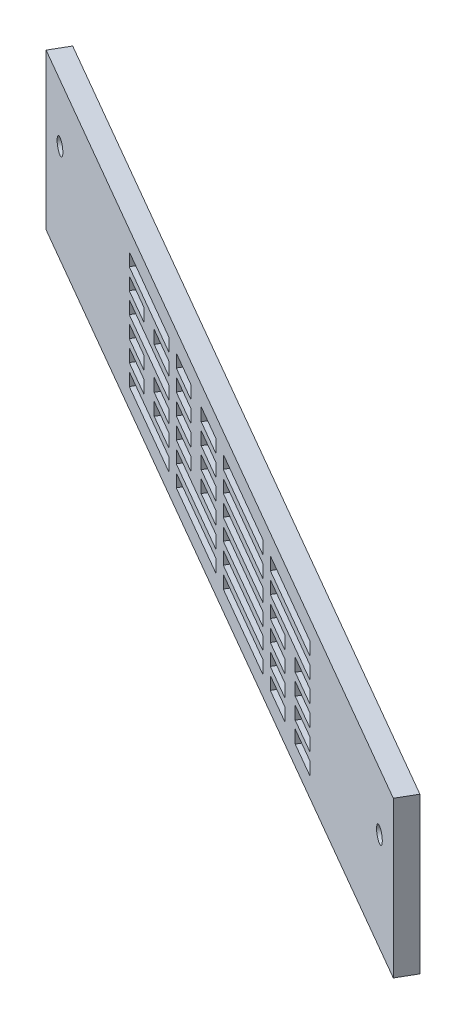
from build123d import *

# Parameters (mm, degrees)
STOCK_FRAME_START              = 163.456714755
STOCK_FRAME_MASTER_1_OUTLINE_W = 121.884572681
STOCK_FRAME_MASTER_1_OUTLINE_H = 40
STOCK_FRAME_MASTER_1_OUTLINE_R = 2
STOCK_FRAME_MASTER_1_DEPTH     = 5
SKETCH1_W                      = 28
SKETCH1_H                      = 3.333333333
SKETCH1_H_2                    = 3.333333334
SKETCH1_W_2                    = 10.5
CUT_EXTRUDE1_DEPTH             = 477.766675556


# Read off the part's stored shape, not the designer's step: Stock-Frame master-1
with BuildPart() as part:
    # Stock-Frame master-1 outline → Stock-Frame master-1 (new body)
    with BuildSketch(Plane(origin=(0, 0, 0), x_dir=(0.866025403784438, 0, 0.500000000000001), z_dir=(0.500000000000001, 0, -0.866025403784438)).offset(STOCK_FRAME_START)):
        with Locations((60.942286341, -439.75)):
            Rectangle(STOCK_FRAME_MASTER_1_OUTLINE_W, STOCK_FRAME_MASTER_1_OUTLINE_H)
        with Locations((112.134572681, -445)):
            Circle(STOCK_FRAME_MASTER_1_OUTLINE_R, mode=Mode.SUBTRACT)
    extrude(amount=STOCK_FRAME_MASTER_1_DEPTH)

    # Mirror1: part across plane


with BuildPart() as part_1:
    add(part.part)
    add(part.part.mirror(Plane(origin=(81.728357378, 459.75, -141.557667397), x_dir=(-0.5000000000000008, 0, 0.8660254037844382), z_dir=(-0.8660254037844383, 0, -0.5000000000000008))))

    # Sketch1 → Cut-Extrude1 (cut, through all)
    with BuildSketch(Plane(origin=(84.228357378, 0, -145.887794416), x_dir=(-0.8660254037844384, 0, -0.5000000000000007), z_dir=(0.5000000000000007, 0, -0.8660254037844384))):
        with Locations((-49.5, 453.083333334)):
            Rectangle(SKETCH1_W, SKETCH1_H)
        with Locations((-49.5, 447.75)):
            Rectangle(SKETCH1_W, SKETCH1_H_2)
        with Locations((-58.25, 442.416666667)):
            Rectangle(SKETCH1_W_2, SKETCH1_H)
        with Locations((-40.75, 442.416666667)):
            Rectangle(SKETCH1_W_2, SKETCH1_H)
        with Locations((-58.25, 437.083333334)):
            Rectangle(SKETCH1_W_2, SKETCH1_H)
        with Locations((-40.75, 437.083333334)):
            Rectangle(SKETCH1_W_2, SKETCH1_H)
        with Locations((-58.25, 431.75)):
            Rectangle(SKETCH1_W_2, SKETCH1_H_2)
        with Locations((-40.75, 431.75)):
            Rectangle(SKETCH1_W_2, SKETCH1_H_2)
        with Locations((-58.25, 426.416666667)):
            Rectangle(SKETCH1_W_2, SKETCH1_H)
        with Locations((-40.75, 426.416666667)):
            Rectangle(SKETCH1_W_2, SKETCH1_H)
        with Locations((-16.5, 453.083333334)):
            Rectangle(SKETCH1_W, SKETCH1_H)
        with Locations((-16.5, 447.75)):
            Rectangle(SKETCH1_W, SKETCH1_H_2)
        with Locations((-16.5, 442.416666667)):
            Rectangle(SKETCH1_W, SKETCH1_H)
        with Locations((-16.5, 437.083333334)):
            Rectangle(SKETCH1_W, SKETCH1_H)
        with Locations((-16.5, 431.75)):
            Rectangle(SKETCH1_W, SKETCH1_H_2)
        with Locations((-16.5, 426.416666667)):
            Rectangle(SKETCH1_W, SKETCH1_H)
        with Locations((7.75, 453.083333334)):
            Rectangle(SKETCH1_W_2, SKETCH1_H)
        with Locations((25.25, 453.083333334)):
            Rectangle(SKETCH1_W_2, SKETCH1_H)
        with Locations((7.75, 447.75)):
            Rectangle(SKETCH1_W_2, SKETCH1_H_2)
        with Locations((7.75, 442.416666667)):
            Rectangle(SKETCH1_W_2, SKETCH1_H)
        with Locations((25.25, 447.75)):
            Rectangle(SKETCH1_W_2, SKETCH1_H_2)
        with Locations((25.25, 442.416666667)):
            Rectangle(SKETCH1_W_2, SKETCH1_H)
        with Locations((7.75, 437.083333334)):
            Rectangle(SKETCH1_W_2, SKETCH1_H)
        with Locations((25.25, 437.083333334)):
            Rectangle(SKETCH1_W_2, SKETCH1_H)
        with Locations((16.5, 431.75)):
            Rectangle(SKETCH1_W, SKETCH1_H_2)
        with Locations((16.5, 426.416666667)):
            Rectangle(SKETCH1_W, SKETCH1_H)
        with Locations((49.5, 453.083333334)):
            Rectangle(SKETCH1_W, SKETCH1_H)
        with Locations((40.75, 447.75)):
            Rectangle(SKETCH1_W_2, SKETCH1_H_2)
        with Locations((58.25, 447.75)):
            Rectangle(SKETCH1_W_2, SKETCH1_H_2)
        with Locations((49.5, 442.416666667)):
            Rectangle(SKETCH1_W, SKETCH1_H)
        with Locations((40.75, 437.083333334)):
            Rectangle(SKETCH1_W_2, SKETCH1_H)
        with Locations((58.25, 437.083333334)):
            Rectangle(SKETCH1_W_2, SKETCH1_H)
        with Locations((40.75, 431.75)):
            Rectangle(SKETCH1_W_2, SKETCH1_H_2)
        with Locations((49.5, 426.416666667)):
            Rectangle(SKETCH1_W, SKETCH1_H)
        with Locations((58.25, 431.75)):
            Rectangle(SKETCH1_W_2, SKETCH1_H_2)
    extrude(amount=-CUT_EXTRUDE1_DEPTH, mode=Mode.SUBTRACT)


solid = part_1.part
